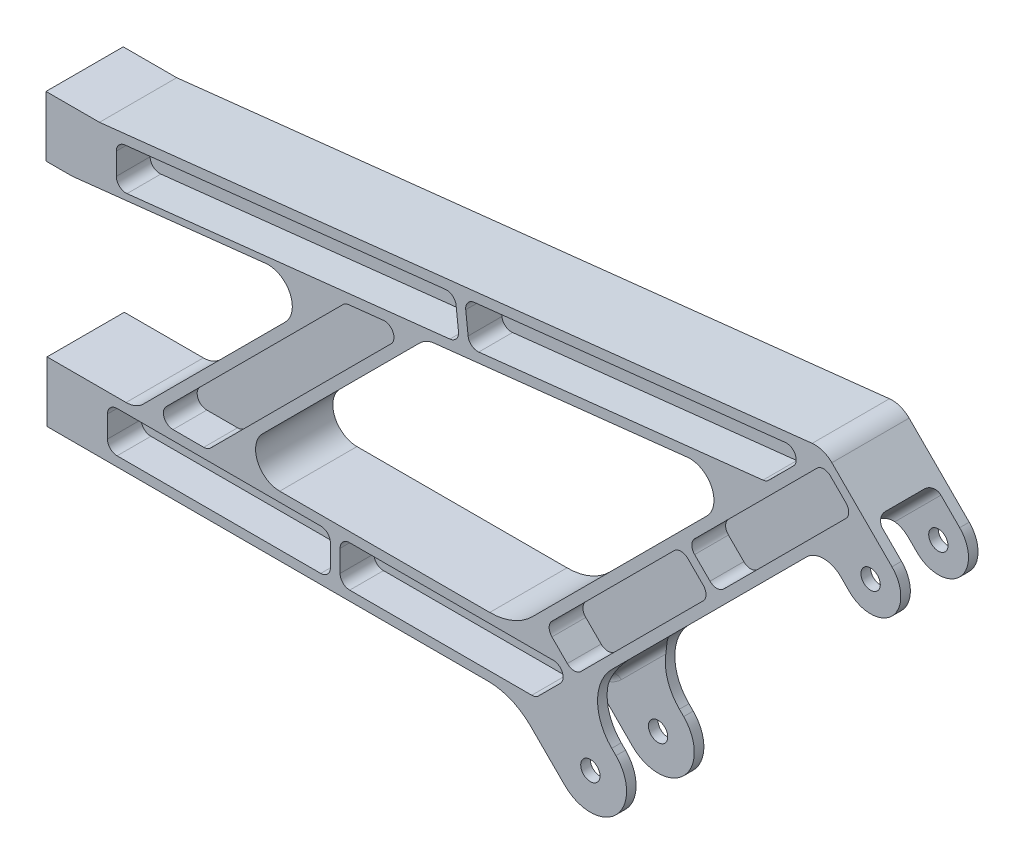
from build123d import *

# Parameters (mm, degrees)
SKETCH1_R               = 4.000000000000007
SKETCH1_R_2             = 4
BOSS_EXTRUDE1_DEPTH     = 32
CUT_EXTRUDE1_DEPTH      = 14
CUT_EXTRUDE2_DEPTH      = 12.0515
CUT_EXTRUDE2_DEPTH_BACK = 12.0515
FILLET1_R               = 4
FILLET2_R               = 4


with BuildPart() as part:
    # Sketch1 → Boss-Extrude1 (new body)
    with BuildSketch(Plane.XY):
        with BuildLine():
            Line((-16.049733998308586, 33.731487378633574), (8.839559805780222, 8.8381095989473))
            ThreePointArc((8.839559805780222, 8.8381095989473), (12.499999986501061, -0.00051272800107638), (8.838834762594171, -8.838834767069468))
            ThreePointArc((8.838834762594171, -8.838834767069468), (-1.5822419e-09, -12.500000000000004), (-8.838834764831827, -8.838834764831867))
            Line((-8.838834764831827, -8.838834764831867), (-12.374368671510593, -5.303300858153129))
            ThreePointArc((-12.374368671510593, -5.303300858153129), (-19.44543648337603, -2.3743686700186277), (-26.516504295241493, -5.303300858153101))
            Line((-26.516504295241493, -5.303300858153101), (-107.24873734525912, -86.0355339081699))
            ThreePointArc((-107.24873734525912, -86.0355339081699), (-113.10660172152828, -100.17766953190096), (-107.24873734525916, -114.31980515563204))
            Line((-107.24873734525916, -114.31980515563204), (-105.48097039229309, -116.0875721085981))
            ThreePointArc((-105.48097039229309, -116.0875721085981), (-101.08757211009126, -126.69417382639631), (-105.48097039229302, -137.30077554419455))
            ThreePointArc((-105.48097039229302, -137.30077554419455), (-116.0875721100912, -141.69417382639634), (-126.69417382788939, -137.3007755441946))
            Line((-126.69417382788939, -137.3007755441946), (-140.83255286115494, -123.16239651092909))
            ThreePointArc((-140.83255286115494, -123.16239651092909), (-148.94313658169136, -117.74307772781059), (-158.5102223908186, -115.84006604059276))
            Line((-158.5102223908186, -115.84006604059276), (-341.13730097225204, -115.84006604059276))
            Line((-341.13730097225204, -115.84006604059276), (-341.1373009722495, -90.84006604059275))
            Line((-341.1373009722495, -90.84006604059275), (-308.41236254138886, -90.84006604059275))
            ThreePointArc((-308.41236254138886, -90.84006604059275), (-304.585528217738, -90.07886136570562), (-301.34129472952344, -87.91113385245822))
            Line((-301.34129472952344, -87.91113385245822), (-242.48138395122018, -29.05122307415505))
            ThreePointArc((-242.48138395122018, -29.05122307415505), (-240.53681891966568, -17.653682746180582), (-250.6448259773551, -12.03999839350729))
            Line((-250.6448259773551, -12.03999839350729), (-330.17931975348506, -20.780446989330915))
            ThreePointArc((-330.17931975348506, -20.780446989330915), (-330.7246878836122, -20.825318129718745), (-331.27169396775446, -20.840290120548637))
            Line((-331.27169396775446, -20.840290120548637), (-341.5776016752601, -20.840290120548637))
            Line((-341.5776016752601, -20.840290120548637), (-341.5776016752601, 4.159709879451362))
            Line((-341.5776016752601, 4.159709879451362), (-319.4176016743681, 4.159709879451346))
            Line((-319.4176016743681, 4.159709879451346), (-24.213756083384812, 36.60115654207939))
            ThreePointArc((-24.213756083384812, 36.60115654207939), (-19.80525783014332, 36.09515683534142), (-16.049733998308586, 33.731487378633574))
        make_face()
        with Locations((-116.08757211009124, -126.69417382639637)):
            Circle(SKETCH1_R, mode=Mode.SUBTRACT)
        with Locations((-2.98344682e-09, -2.98341907e-09)):
            Circle(SKETCH1_R_2, mode=Mode.SUBTRACT)
        with BuildLine():
            Line((-157.76394759633592, -90.84006604059275), (-244.77275223459964, -90.84006604059276))
            ThreePointArc((-244.77275223459964, -90.84006604059276), (-254.0115475597125, -84.66690036424366), (-251.84382004646505, -73.76899822872734))
            Line((-251.84382004646505, -73.76899822872734), (-186.6917658288417, -8.616944011103918))
            ThreePointArc((-186.6917658288417, -8.616944011103918), (-183.94717053308534, -6.6723789795494355), (-180.71307223124595, -5.747854954187154))
            Line((-180.71307223124595, -5.747854954187154), (-75.9815909030455, 5.76161830015324))
            ThreePointArc((-75.9815909030455, 5.76161830015324), (-65.87358384535577, 0.14793394747996658), (-67.81814887691054, -11.249606380494681))
            Line((-67.81814887691054, -11.249606380494681), (-140.08627806667224, -83.51773557025643))
            ThreePointArc((-140.08627806667224, -83.51773557025643), (-148.1968617872087, -88.93705435337492), (-157.76394759633592, -90.84006604059275))
        make_face(mode=Mode.SUBTRACT)
    extrude(amount=BOSS_EXTRUDE1_DEPTH)

    # Sketch2 → Cut-Extrude1 (cut)
    with BuildSketch(Plane.XY.offset(32)):
        with BuildLine():
            ThreePointArc((-140.36697797666704, -111.84006604059275), (-138.83624424720668, -111.5355841706379), (-137.53855085192086, -110.66849316533893))
            Line((-137.53855085192086, -110.66849316533893), (-128.53855085192086, -101.66849316533907))
            ThreePointArc((-128.53855085192086, -101.66849316533907), (-127.67145984662184, -97.30933231113245), (-131.36697797666707, -94.84006604059279))
            Line((-131.36697797666707, -94.84006604059279), (-215.7700216370809, -94.8400660405928))
            ThreePointArc((-215.7700216370809, -94.8400660405928), (-218.59844876182711, -96.01163891584663), (-219.77002163708093, -98.84006604059284))
            Line((-219.77002163708093, -98.84006604059284), (-219.77002163708093, -107.84006604059273))
            ThreePointArc((-219.77002163708093, -107.84006604059273), (-218.59844876182711, -110.66849316533894), (-215.7700216370809, -111.84006604059277))
            Line((-215.7700216370809, -111.84006604059277), (-140.36697797666704, -111.84006604059275))
        make_face()
        with BuildLine():
            ThreePointArc((-16.614921092650253, 28.639448841971976), (-19.44341616830374, 29.811253754782516), (-22.27200736402945, 28.63968088289363))
            Line((-22.27200736402945, 28.63968088289363), (-72.89302846182751, -21.98134021490415))
            ThreePointArc((-72.89302846182751, -21.981340214904154), (-74.06460133708134, -24.809767339650364), (-72.89302846182751, -27.638194464396573))
            Line((-72.89302846182751, -27.638194464396573), (-66.52906743114904, -34.00215549507503))
            ThreePointArc((-66.52906743114904, -34.00215549507503), (-63.70064030640285, -35.17372837032886), (-60.872213181656655, -34.00215549507506))
            Line((-60.872213181656655, -34.00215549507506), (-10.251714154519497, 16.618343532061083))
            ThreePointArc((-10.251714154519505, 16.618343532061086), (-9.080141282630589, 19.446606585827766), (-10.251482132632672, 22.27496574063185))
            Line((-10.251482132632672, 22.27496574063185), (-16.614921092650253, 28.639448841971976))
        make_face()
        with BuildLine():
            ThreePointArc((-125.63351365610953, -93.10660172003544), (-122.80508653136334, -94.27817459528924), (-119.97665940661716, -93.10660172003546))
            Line((-119.97665940661716, -93.10660172003546), (-69.35749455589527, -42.48743686931361))
            ThreePointArc((-69.35749455589527, -42.48743686931361), (-68.18592168064143, -39.6590097445674), (-69.35749455589527, -36.83058261982118))
            Line((-69.35749455589527, -36.83058261982118), (-75.7214555865737, -30.466621589142765))
            ThreePointArc((-75.7214555865737, -30.46662158914276), (-78.5498827113199, -29.295048713888928), (-81.37830983606611, -30.46662158914277))
            Line((-81.37830983606611, -30.466621589142765), (-131.99747468678797, -81.08578643986458))
            ThreePointArc((-131.99747468678797, -81.08578643986458), (-133.1690475620418, -83.91421356461078), (-131.997474686788, -86.74264068935697))
            Line((-131.997474686788, -86.74264068935697), (-125.63351365610953, -93.10660172003544))
        make_face()
        with BuildLine():
            ThreePointArc((-316.1373009722494, -107.84006604059273), (-314.96572809699563, -110.66849316533893), (-312.1373009722494, -111.84006604059276))
            Line((-312.1373009722494, -111.84006604059275), (-227.77002163708124, -111.84006604059277))
            ThreePointArc((-227.77002163708124, -111.84006604059277), (-224.94159451233503, -110.66849316533894), (-223.77002163708121, -107.84006604059273))
            Line((-223.77002163708121, -107.84006604059273), (-223.77002163708121, -98.84006604059284))
            ThreePointArc((-223.77002163708121, -98.84006604059284), (-224.94159451233503, -96.01163891584663), (-227.77002163708124, -94.8400660405928))
            Line((-227.77002163708124, -94.8400660405928), (-312.1373009722494, -94.84006604059279))
            ThreePointArc((-312.1373009722494, -94.8400660405928), (-314.96572809699563, -96.01163891584659), (-316.1373009722494, -98.84006604059279))
            Line((-316.1373009722494, -98.84006604059279), (-316.1373009722494, -107.84006604059273))
        make_face()
        with BuildLine():
            Line((-176.10914312924507, 15.884521302439035), (-308.8907187483117, 1.2924810307345336))
            ThreePointArc((-308.8907187483117, 1.2924810307345425), (-311.4326781534316, -0.01410599510857358), (-312.45376906260395, -2.6835817167783773))
            Line((-312.45376906260395, -2.6835817167783773), (-312.4537690626033, -11.737764783317964))
            ThreePointArc((-312.4537690626033, -11.737764783317964), (-311.123244784273, -14.716673874145663), (-308.01681937689534, -15.713827530830894))
            Line((-308.01681937689534, -15.713827530830859), (-174.25210696498712, -1.0137453744908704))
            ThreePointArc((-174.25210696498712, -1.01374537449087), (-171.56858563370398, 0.45978652763373384), (-170.71299390318194, 3.399267058729826))
            Line((-170.71299390318194, 3.3992670587298264), (-171.69613069602437, 12.345408240633859))
            ThreePointArc((-171.69613069602437, 12.345408240633857), (-173.169662598149, 15.028929571917006), (-176.10914312924507, 15.884521302439046))
        make_face()
        with BuildLine():
            Line((-42.183809278934454, 14.384733217481418), (-32.01176917416371, 24.556773322252173))
            ThreePointArc((-32.01176917416371, 24.556773322252173), (-31.233943161541813, 29.115789453442037), (-35.277145984617704, 31.361263194511345))
            Line((-35.277145984617704, 31.361263194511345), (-164.18095488670633, 17.195370359562308))
            ThreePointArc((-164.18095488670633, 17.195370359562315), (-166.86447621798948, 15.721838457437714), (-167.7200679485115, 12.782357926341632))
            Line((-167.7200679485115, 12.782357926341632), (-166.73693115566908, 3.836216744437582))
            ThreePointArc((-166.73693115566908, 3.836216744437583), (-165.2633992535445, 1.1526954131544191), (-162.32391872244838, 0.2971036826323883))
            Line((-162.32391872244838, 0.29710368263239556), (-44.575286717972915, 13.237097594714685))
            ThreePointArc((-44.575286717972915, 13.237097594714685), (-43.28164739723707, 13.606907204859585), (-42.183809278934454, 14.384733217481418))
        make_face()
        with BuildLine():
            ThreePointArc((-216.1743379728295, -9.64487316152837), (-217.46797729356527, -10.014682771673261), (-218.56581541186782, -10.792508784295057))
            Line((-218.56581541186782, -10.79250878429506), (-291.78494554341927, -84.01163891584659))
            ThreePointArc((-291.78494554341927, -84.01163891584659), (-292.65203654871823, -88.3707997700531), (-288.9565184186731, -90.84006604059273))
            Line((-288.9565184186731, -90.84006604059275), (-276.2285963573152, -90.84006604059276))
            ThreePointArc((-276.2285963573152, -90.84006604059275), (-274.6978626278549, -90.53558417063789), (-273.40016923256906, -89.66849316533896))
            Line((-273.40016923256906, -89.66849316533896), (-198.60961104904442, -14.87793498181431))
            ThreePointArc((-198.60961104904442, -14.877934981814308), (-197.83178503642264, -10.31891885062449), (-201.8749878594985, -8.073445109555244))
            Line((-201.8749878594985, -8.073445109555252), (-216.1743379728295, -9.644873161528363))
        make_face()
    cut_extrude1 = extrude(amount=-CUT_EXTRUDE1_DEPTH, mode=Mode.SUBTRACT)

    # Mirror1: Cut-Extrude1 across plane
    add(cut_extrude1.mirror(Plane.XY.offset(16)), mode=Mode.SUBTRACT)

    # Sketch3 → Cut-Extrude2 (cut, two sides: drawn at the far end of the back side and taken through both)
    with BuildSketch(Plane.XY.offset(16).offset(-CUT_EXTRUDE2_DEPTH_BACK)):
        with BuildLine():
            Line((-158.5102223908186, -115.84006604059276), (-141.19540510141326, -115.84006604059277))
            ThreePointArc((-141.19540510141326, -115.84006604059277), (-137.3685707777624, -115.07886136570563), (-134.1243372895478, -112.91113385245826))
            Line((-134.1243372895478, -112.91113385245826), (-98.96898095039894, -77.75577751330981))
            Line((-98.96898095039894, -77.75577751330981), (-66.35974339813797, -110.01855027197146))
            Line((-66.35974339813797, -110.01855027197146), (-116.59713847003755, -149.21856691920738))
            Line((-116.59713847003755, -149.21856691920738), (-158.5102223908186, -115.84006604059276))
        make_face()
        Polygon((-29.015558543217246, -7.8023551061288385), (7.8698142046997255, 29.08301764178775), (26.353299234567167, -15.387889096839226), (-12.041020580309814, -17.81897048249737), align=None)
    extrude(amount=CUT_EXTRUDE2_DEPTH + CUT_EXTRUDE2_DEPTH_BACK, mode=Mode.SUBTRACT)

    # Fillet1
    fillet1_edges = [part.edges().sort_by_distance(p)[0] for p in [
        (-14.141700563915723, 7.07150287317253, 28.0515),
        (-14.141700563915723, 7.07150287317253, 3.9484999999999992),
    ]]
    fillet(fillet1_edges, radius=FILLET1_R)

    # Fillet2
    fillet2_edges = [part.edges().sort_by_distance(p)[0] for p in [
        (-149.85281374611594, -115.84006604059277, 3.9484999999999992),
        (-137.3685707777624, -115.07886136570563, 3.9484999999999992),
        (-149.85281374611594, -115.84006604059277, 28.0515),
        (-137.3685707777624, -115.07886136570563, 28.0515),
        (-120.68653731740346, -99.47333388031407, 3.9484999999999992),
        (-120.68653731740346, -99.47333388031407, 28.0515),
    ]]
    fillet(fillet2_edges, radius=FILLET2_R)


solid = part.part
